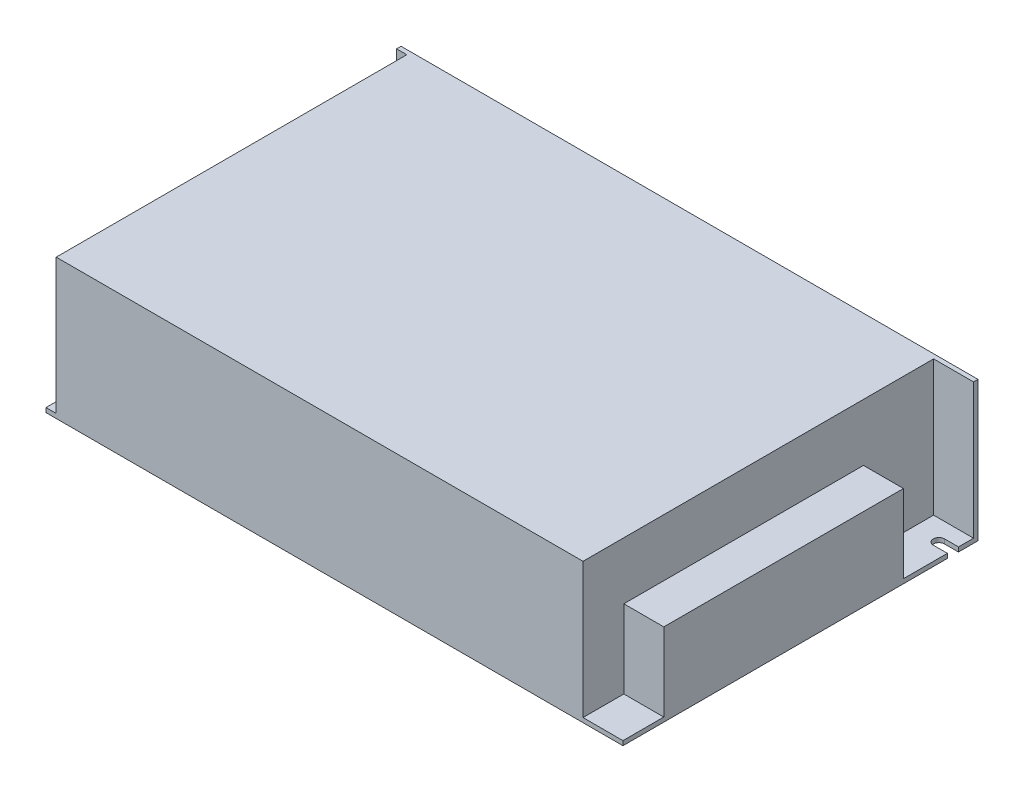
from build123d import *

# Parameters (mm, degrees)
SKETCH1_W           = 165.1
SKETCH1_H           = 101.6
BOSS_EXTRUDE1_DEPTH = 40
SKETCH2_W           = 100.33
SKETCH2_H           = 38.73
CUT_EXTRUDE1_DEPTH  = 11.43
SKETCH3_W           = 100.33
SKETCH3_H           = 38.73
CUT_EXTRUDE2_DEPTH  = 2.921
SKETCH4_W           = 11.43
SKETCH4_H           = 68.58
BOSS_EXTRUDE2_DEPTH = 22.352
CUT_EXTRUDE3_DEPTH  = 22.352
SKETCH6_R           = 1.27
CUT_EXTRUDE4_DEPTH  = 10.16


with BuildPart() as part:
    # Sketch1 → Boss-Extrude1 (new body)
    with BuildSketch(Plane(origin=(0, 0, 0), x_dir=(1, 0, 0), z_dir=(0, 1, 0))):
        with Locations((82.55, 50.8)):
            Rectangle(SKETCH1_W, SKETCH1_H)
    extrude(amount=BOSS_EXTRUDE1_DEPTH)

    # Sketch2 → Cut-Extrude1 (cut)
    with BuildSketch(Plane(origin=(165.1, 0, 0), x_dir=(0, 0, -1), z_dir=(1, 0, 0))):
        with Locations((50.165, 20.635)):
            Rectangle(SKETCH2_W, SKETCH2_H)
    extrude(amount=-CUT_EXTRUDE1_DEPTH, mode=Mode.SUBTRACT)

    # Sketch3 → Cut-Extrude2 (cut)
    with BuildSketch(Plane.ZY):
        with Locations((-50.165, 20.635)):
            Rectangle(SKETCH3_W, SKETCH3_H)
    extrude(amount=-CUT_EXTRUDE2_DEPTH, mode=Mode.SUBTRACT)

    # Sketch4 → Boss-Extrude2 (add)
    with BuildSketch(Plane(origin=(0, 1.27, 0), x_dir=(1, 0, 0), z_dir=(0, 1, 0))):
        with Locations((159.385, 45.974)):
            Rectangle(SKETCH4_W, SKETCH4_H)
    extrude(amount=BOSS_EXTRUDE2_DEPTH)

    # Sketch5 → Cut-Extrude3 (cut)
    with BuildSketch(Plane(origin=(0, 1.27, 0), x_dir=(1, 0, 0), z_dir=(0, 1, 0))):
        with BuildLine():
            Line((0, 8.255), (0, 5.08))
            Line((0, 5.08), (4.0005, 5.08))
            ThreePointArc((4.0005, 5.08), (5.588, 6.6675), (4.0005, 8.255))
            Line((4.0005, 8.255), (0, 8.255))
        make_face()
        with BuildLine():
            Line((165.1, 92.837), (165.1, 96.012))
            Line((165.1, 96.012), (161.0995, 96.012))
            ThreePointArc((161.0995, 96.012), (159.512, 94.4245), (161.0995, 92.837))
            Line((161.0995, 92.837), (165.1, 92.837))
        make_face()
    extrude(amount=-CUT_EXTRUDE3_DEPTH, mode=Mode.SUBTRACT)

    # Sketch6 → Cut-Extrude4 (cut)
    with BuildSketch(Plane.XZ):
        with Locations((63.246, -65.278)):
            Circle(SKETCH6_R)
        with Locations((140.97, -65.278)):
            Circle(SKETCH6_R)
    extrude(amount=-CUT_EXTRUDE4_DEPTH, mode=Mode.SUBTRACT)


solid = part.part
